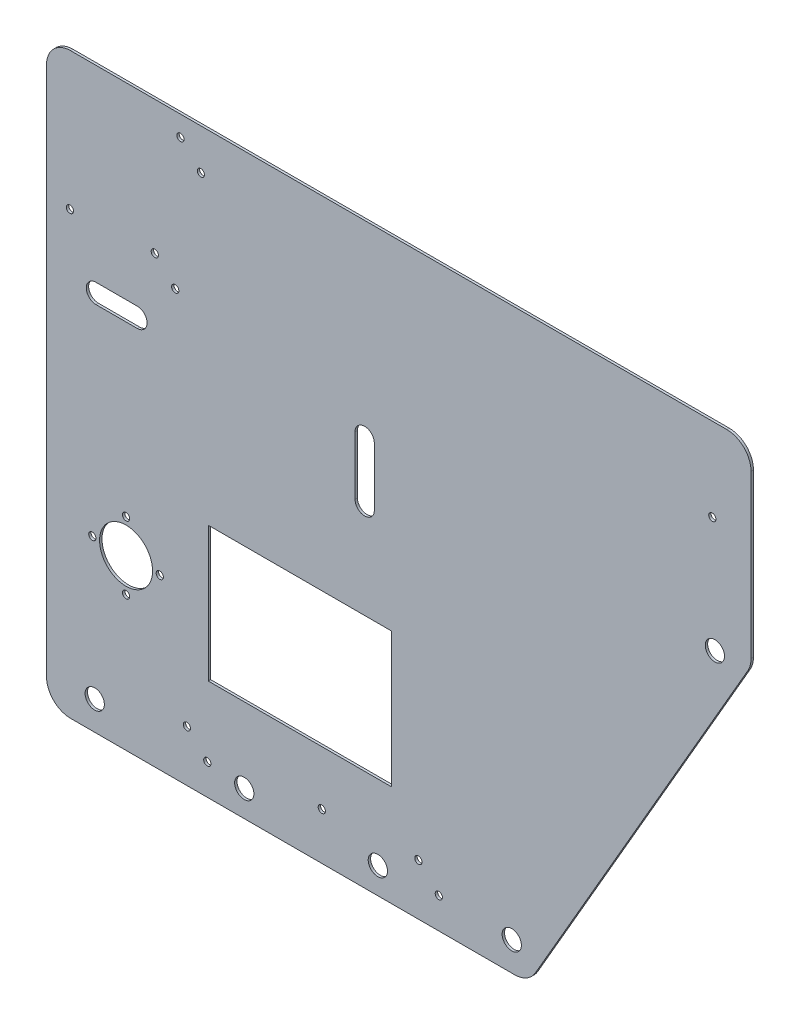
from build123d import *

# Parameters (mm, degrees)
BOSS_EXTRUDE1_DEPTH = 1
SKETCH2_R           = 4
SKETCH2_R_2         = 11
SKETCH2_R_3         = 1.5
SKETCH2_W           = 76
SKETCH2_H           = 56
CUT_EXTRUDE1_DEPTH  = 3
SKETCH3_W           = 292.37604307
SKETCH3_H           = 50
BOSS_EXTRUDE2_DEPTH = 1
FILLET1_R           = 10
SKETCH4_R           = 1.5
CUT_EXTRUDE2_DEPTH  = 11


with BuildPart() as part:
    # Sketch1 → Boss-Extrude1 (new body)
    with BuildSketch(Plane.XY):
        Polygon((-100, 110), (-100, -80), (100, -80), (192.37604307, 80), (192.37604307, 110), align=None)
    extrude(amount=BOSS_EXTRUDE1_DEPTH)

    # Sketch2 → Cut-Extrude1 (cut)
    with BuildSketch(Plane.XY.offset(1)):
        with Locations((93.07179677, -68)):
            Circle(SKETCH2_R)
        with Locations((177.364936071, 78)):
            Circle(SKETCH2_R)
        with Locations((-67, -10)):
            Circle(SKETCH2_R_2)
        with Locations((-80, -68)):
            Circle(SKETCH2_R)
        with Locations((-53, -10)):
            Circle(SKETCH2_R_3)
        with Locations((-67, 4)):
            Circle(SKETCH2_R_3)
        with Locations((-81, -10)):
            Circle(SKETCH2_R_3)
        with Locations((-67, -24)):
            Circle(SKETCH2_R_3)
        with Locations((62.79605759, -67.242640687)):
            Circle(SKETCH2_R_3)
        with Locations((54.310776216, -58.757359313)):
            Circle(SKETCH2_R_3)
        with Locations((-33.274226936, -67.242640687)):
            Circle(SKETCH2_R_3)
        with Locations((-41.75950831, -58.757359313)):
            Circle(SKETCH2_R_3)
        with Locations((14.225855729, -60.5)):
            Circle(SKETCH2_R_3)
        with Locations((-46.588971723, 96.138798421)):
            Circle(SKETCH2_R_3)
        with Locations((-55.074253097, 104.624079796)):
            Circle(SKETCH2_R_3)
        with Locations((-90.295627115, 102.881439108)):
            Circle(SKETCH2_R_3)
        with Locations((176.305585362, 125.488938255)):
            Circle(SKETCH2_R_3)
        with Locations((-17.947932492, -69.117445741)):
            Circle(SKETCH2_R)
        with Locations((37.494421294, -69.117445741)):
            Circle(SKETCH2_R)
        with BuildLine():
            Line((-79.516586773, 82), (-62.300333374, 82))
            ThreePointArc((-62.300333374, 82), (-58.300333374, 78), (-62.300333374, 74))
            Line((-62.300333374, 74), (-79.516586773, 74))
            ThreePointArc((-79.516586773, 74), (-83.516586773, 78), (-79.516586773, 82))
        make_face()
        with Locations((5.141640745, -10)):
            Rectangle(SKETCH2_W, SKETCH2_H)
        with BuildLine():
            Line((36.026164778, 82), (36.026164778, 57.777585682))
            ThreePointArc((36.026164778, 57.777585682), (32.026164778, 53.777585682), (28.026164778, 57.777585682))
            Line((28.026164778, 57.777585682), (28.026164778, 82))
            ThreePointArc((28.026164778, 82), (32.026164778, 86), (36.026164778, 82))
        make_face()
    extrude(amount=-CUT_EXTRUDE1_DEPTH, mode=Mode.SUBTRACT)

    # Sketch3 → Boss-Extrude2 (add)
    with BuildSketch(Plane.XY.offset(1)):
        with Locations((46.188021535, 135)):
            Rectangle(SKETCH3_W, SKETCH3_H)
    extrude(amount=-BOSS_EXTRUDE2_DEPTH)

    # Fillet1
    fillet1_edges = [part.edges().sort_by_distance(p)[0] for p in [
        (100, -80, 0.5),
        (-100, -80, 0.5),
        (-100, 160, 0.5),
        (192.37604307, 160, 0.5),
        (192.37604307, 80, 0.5),
    ]]
    fillet(fillet1_edges, radius=FILLET1_R)

    # Sketch4 → Cut-Extrude2 (cut)
    with BuildSketch(Plane.XY.offset(1)):
        with Locations((-44.442274409, 151.624079796)):
            Circle(SKETCH4_R)
        with Locations((-35.956993035, 143.138798421)):
            Circle(SKETCH4_R)
        with Locations((176.305585362, 125.488938255)):
            Circle(SKETCH4_R)
    extrude(amount=-CUT_EXTRUDE2_DEPTH, mode=Mode.SUBTRACT)


solid = part.part
